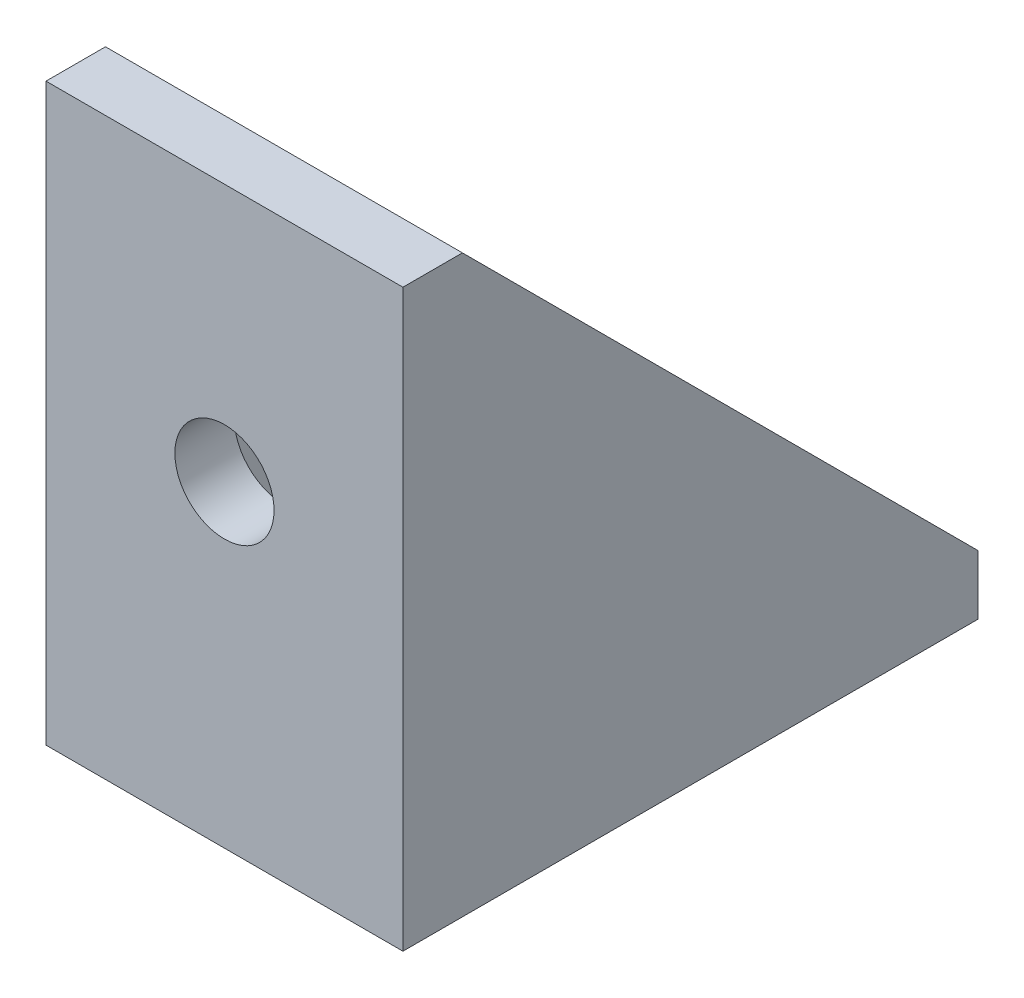
from build123d import *

# Parameters (mm, degrees)
EXTRUDE_THIN1_DEPTH      = 9
EXTRUDE_THIN1_DEPTH_BACK = 9
RIB1_REACH               = 46.788
SKETCH2_WALL_W           = 128.346335328
SKETCH2_WALL_H           = 2
SKETCH3_R                = 2.5
CUT_EXTRUDE1_DEPTH       = 10
SKETCH4_R                = 2.5
CUT_EXTRUDE2_DEPTH       = 10


with BuildPart() as part:
    # Sketch1 → Extrude-Thin1 (new, two sides: drawn at the far end of the back side and taken through both)
    with BuildSketch(Plane(origin=(0, 0, 0), x_dir=(0, 0, -1), z_dir=(1, 0, 0)).offset(-EXTRUDE_THIN1_DEPTH_BACK)):
        Polygon((0, 29), (0, 0), (29, 0), (29, 3), (3, 3), (3, 29), align=None)
    extrude(amount=EXTRUDE_THIN1_DEPTH + EXTRUDE_THIN1_DEPTH_BACK)

    # Sketch2 wall → Rib1 (add, up to next)
    with BuildSketch(Plane(origin=(9, 16, -16), x_dir=(0, -0.707106781187, -0.707106781187), z_dir=(0, 0.707106781187, -0.707106781187)), mode=Mode.PRIVATE) as rib1_sk1:
        with Locations((0, 1)):
            Rectangle(SKETCH2_WALL_W, SKETCH2_WALL_H)
    rib1_tool1 = extrude(rib1_sk1.sketch, amount=-RIB1_REACH, mode=Mode.PRIVATE) - part.part
    rib1 = rib1_tool1.solids().sort_by_distance((9, 16, -16))[0]
    add(rib1)

    # Mirror1: Rib1 across plane
    add(rib1.mirror(Plane(origin=(0, 0, 0), x_dir=(0, 0, 1), z_dir=(1, 0, 0))))

    # Sketch3 → Cut-Extrude1 (cut)
    with BuildSketch(Plane(origin=(0, 3, 0), x_dir=(1, 0, 0), z_dir=(0, 1, 0))):
        with Locations((0, 16)):
            Circle(SKETCH3_R)
    extrude(amount=-CUT_EXTRUDE1_DEPTH, mode=Mode.SUBTRACT)

    # Sketch4 → Cut-Extrude2 (cut)
    with BuildSketch(Plane(origin=(0, 0, -3), x_dir=(-1, 0, 0), z_dir=(0, 0, -1))):
        with Locations((0, 16)):
            Circle(SKETCH4_R)
    extrude(amount=-CUT_EXTRUDE2_DEPTH, mode=Mode.SUBTRACT)


solid = part.part
